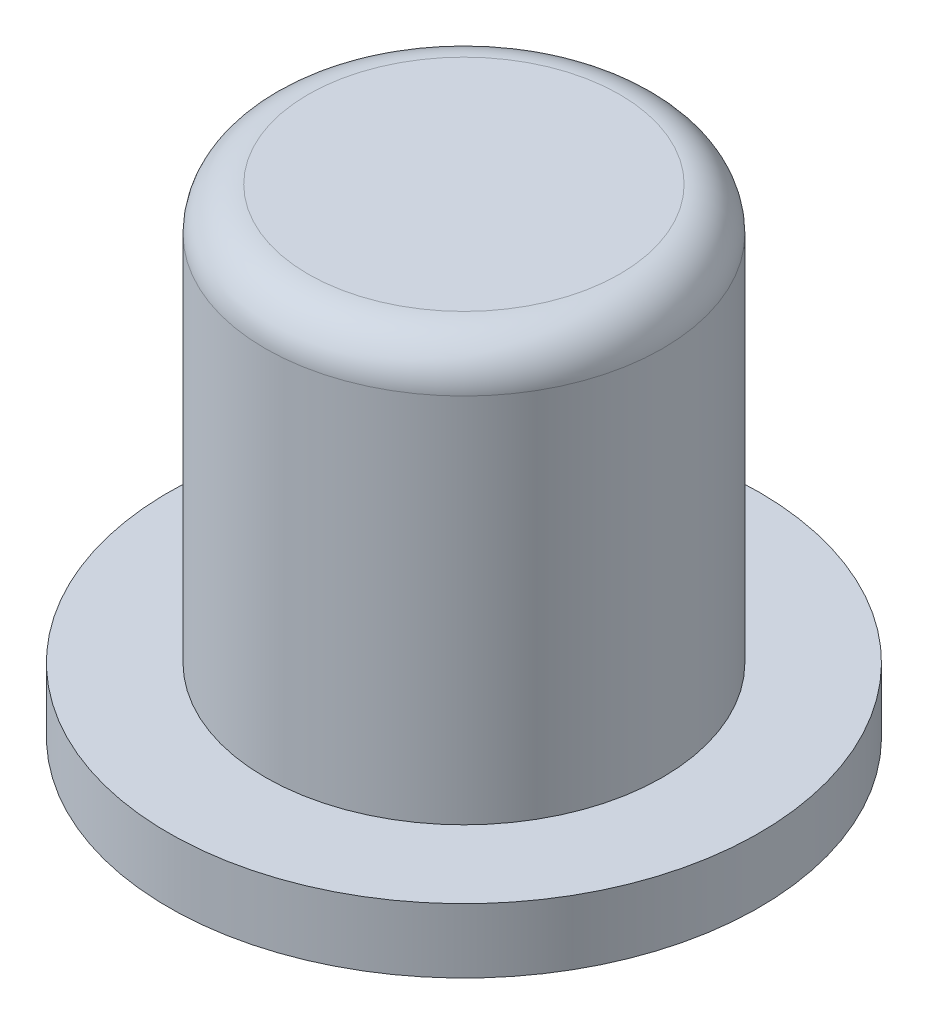
from build123d import *

# Parameters (mm, degrees)
SKETCH1_R           = 3.4925
BOSS_EXTRUDE1_DEPTH = 0.762
SKETCH2_R           = 2.35
BOSS_EXTRUDE2_DEPTH = 4.9
FILLET1_R           = 0.508


with BuildPart() as part:
    # Sketch1 → Boss-Extrude1 (new body)
    with BuildSketch(Plane(origin=(0, 0, 0), x_dir=(1, 0, 0), z_dir=(0, 1, 0))):
        Circle(SKETCH1_R)
    extrude(amount=BOSS_EXTRUDE1_DEPTH)

    # Sketch2 → Boss-Extrude2 (add)
    with BuildSketch(Plane(origin=(0, 0.762, 0), x_dir=(1, 0, 0), z_dir=(0, 1, 0))):
        Circle(SKETCH2_R)
    extrude(amount=BOSS_EXTRUDE2_DEPTH)

    # Fillet1
    fillet1_edges = [part.edges().sort_by_distance(p)[0] for p in [
        (-2.35, 5.662, 0),
    ]]
    fillet(fillet1_edges, radius=FILLET1_R)


solid = part.part
